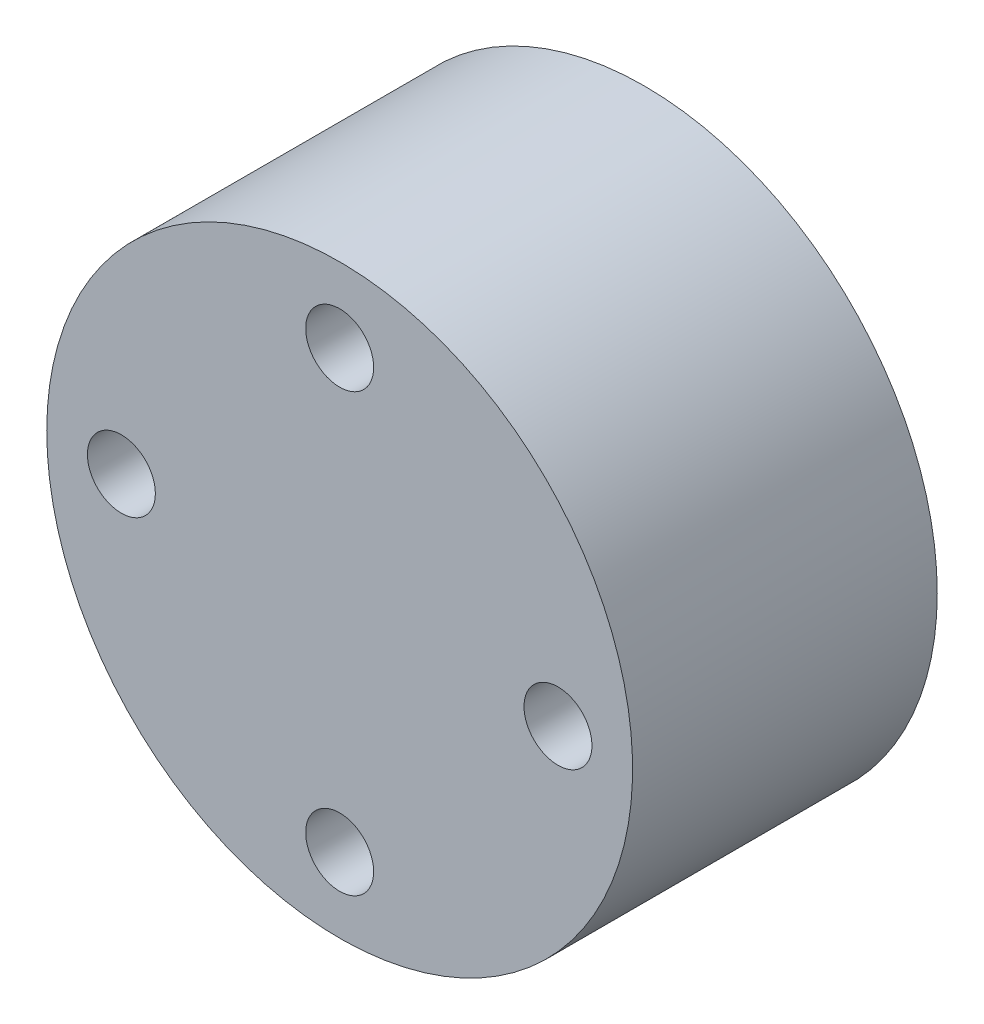
from build123d import *
from build123d.topology import SkipClean

# Parameters (mm, degrees)
SKETCH1_R           = 12.5
BOSS_EXTRUDE1_DEPTH = 5
SKETCH2_W           = 3
SKETCH2_H           = 12.5
SKETCH5_R           = 1.45
CUT_EXTRUDE1_DEPTH  = 5
SKETCH6_R           = 1.45
CUT_EXTRUDE2_DEPTH  = 5


with BuildPart() as part:
    # Sketch1 → Boss-Extrude1 (new, symmetric)
    with BuildSketch(Plane.XY):
        Circle(SKETCH1_R)
    extrude(amount=BOSS_EXTRUDE1_DEPTH, both=True)

    # Sketch2 → Revolve1 (revolve)
    with SkipClean():  # the faces are left unmerged after this step: merging them gives an invalid solid
        with BuildSketch(Plane(origin=(0, 0, 0), x_dir=(0, 0, -1), z_dir=(1, 0, 0))):
            with Locations((-6.5, 6.25)):
                Rectangle(SKETCH2_W, SKETCH2_H)
        revolve(axis=Axis((0, 0, 0), (0, 0, 1)))

    # Sketch5 → Cut-Extrude1 (cut)
    with SkipClean():  # the faces are left unmerged after this step: merging them gives an invalid solid
        with BuildSketch(Plane.XY.offset(8)):
            with Locations((0, 9.315)):
                Circle(SKETCH5_R)
            with Locations((9.315, 0)):
                Circle(SKETCH5_R)
            with Locations((0, -9.315)):
                Circle(SKETCH5_R)
            with Locations((-9.315, 0)):
                Circle(SKETCH5_R)
        extrude(amount=-CUT_EXTRUDE1_DEPTH, mode=Mode.SUBTRACT)

    # Sketch6 → Cut-Extrude2 (cut)
    with SkipClean():  # the faces are left unmerged after this step: merging them gives an invalid solid
        with BuildSketch(Plane(origin=(0, 0, -5), x_dir=(-1, 0, 0), z_dir=(0, 0, -1))):
            with Locations((0, 8)):
                Circle(SKETCH6_R)
            with Locations((8, 0)):
                Circle(SKETCH6_R)
            with Locations((0, -8)):
                Circle(SKETCH6_R)
            with Locations((-8, 0)):
                Circle(SKETCH6_R)
        extrude(amount=-CUT_EXTRUDE2_DEPTH, mode=Mode.SUBTRACT)


solid = part.part
